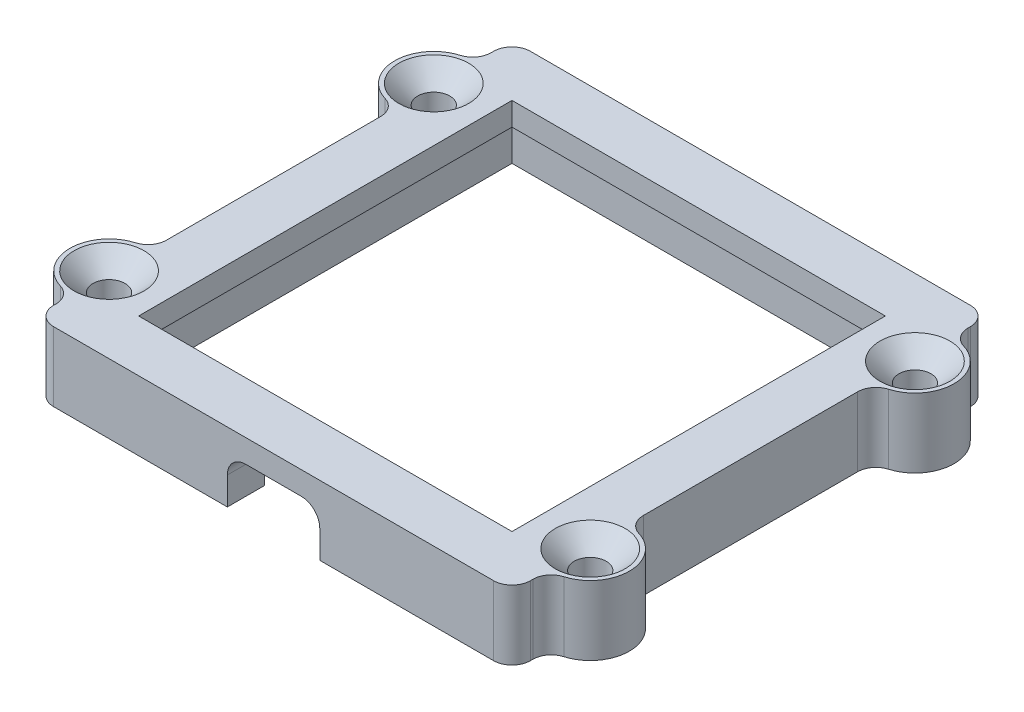
from build123d import *
from build123d.topology import SkipClean

# Parameters (mm, degrees)
BOSS_EXTRUDE1_DEPTH            = 3.175
SKETCH2_R                      = 1.1
SKETCH2_W                      = 27.686
SKETCH2_H                      = 27.686
SKETCH2_W_2                    = 25.654
SKETCH2_H_2                    = 25.654
BOSS_EXTRUDE2_DEPTH            = 1.5875
CHAMFER1_SIZE                  = 1.3
FILLET1_R                      = 1.27
CUT_EXTRUDE1_REACH             = 48.79
SKETCH3_W                      = 6.35
SKETCH3_H                      = 3.175
CUT_EXTRUDE1_DIRECTION_2_DEPTH = 47.790190032
FILLET2_R                      = 1.27


with BuildPart() as part:
    # Sketch1 → Boss-Extrude1 (new body)
    with BuildSketch(Plane(origin=(0, 0, 0), x_dir=(1, 0, 0), z_dir=(0, 1, 0))):
        with BuildLine():
            ThreePointArc((-2.54, 27.681949273), (-5.375, 24.9985), (-2.54, 22.315050727))
            Line((-2.54, 22.315050727), (-2.54, 23.908434062))
            ThreePointArc((-2.54, 23.908434062), (-3.7875, 24.9985), (-2.54, 26.088565938))
            Line((-2.54, 26.088565938), (-2.54, 27.681949273))
        make_face()
        with BuildLine():
            Line((-2.54, 23.908434062), (-2.54, 22.315050727))
            ThreePointArc((-2.54, 22.315050727), (-0.735697948, 23.151035521), (0, 24.9985))
            ThreePointArc((0, 24.9985), (-0.735697948, 26.845964479), (-2.54, 27.681949273))
            Line((-2.54, 27.681949273), (-2.54, 26.088565938))
            ThreePointArc((-2.54, 26.088565938), (-1.859173374, 25.722292097), (-1.5875, 24.9985))
            ThreePointArc((-1.5875, 24.9985), (-1.859173374, 24.274707903), (-2.54, 23.908434062))
        make_face()
        with BuildLine():
            ThreePointArc((-2.54, 27.681949273), (-0.735697948, 26.845964479), (0, 24.9985))
            Line((0, 24.9985), (0, 27.686))
            Line((0, 27.686), (27.686, 27.686))
            Line((27.686, 27.686), (27.686, 24.9985))
            ThreePointArc((27.686, 24.9985), (28.421697948, 26.845964479), (30.226, 27.681949273))
            Line((30.226, 27.681949273), (30.226, 30.226))
            Line((30.226, 30.226), (-2.54, 30.226))
            Line((-2.54, 30.226), (-2.54, 27.681949273))
        make_face()
        with BuildLine():
            ThreePointArc((-2.54, 27.681949273), (-5.375, 24.9985), (-2.54, 22.315050727))
            Line((-2.54, 22.315050727), (-2.54, 23.908434062))
            ThreePointArc((-2.54, 23.908434062), (-3.7875, 24.9985), (-2.54, 26.088565938))
            Line((-2.54, 26.088565938), (-2.54, 27.681949273))
        make_face()
        with BuildLine():
            Line((-2.54, 23.908434062), (-2.54, 22.315050727))
            ThreePointArc((-2.54, 22.315050727), (-0.735697948, 23.151035521), (0, 24.9985))
            ThreePointArc((0, 24.9985), (-0.735697948, 26.845964479), (-2.54, 27.681949273))
            Line((-2.54, 27.681949273), (-2.54, 26.088565938))
            ThreePointArc((-2.54, 26.088565938), (-1.859173374, 25.722292097), (-1.5875, 24.9985))
            ThreePointArc((-1.5875, 24.9985), (-1.859173374, 24.274707903), (-2.54, 23.908434062))
        make_face()
        with BuildLine():
            ThreePointArc((-2.54, 5.370949273), (-5.375, 2.6875), (-2.54, 0.004050727))
            Line((-2.54, 0.004050727), (-2.54, 1.597434062))
            ThreePointArc((-2.54, 1.597434062), (-3.7875, 2.6875), (-2.54, 3.777565938))
            Line((-2.54, 3.777565938), (-2.54, 5.370949273))
        make_face()
        with BuildLine():
            Line((-2.54, 1.597434062), (-2.54, 0.004050727))
            ThreePointArc((-2.54, 0.004050727), (-0.735697948, 0.840035521), (0, 2.6875))
            ThreePointArc((0, 2.6875), (-0.735697948, 4.534964479), (-2.54, 5.370949273))
            Line((-2.54, 5.370949273), (-2.54, 3.777565938))
            ThreePointArc((-2.54, 3.777565938), (-1.859173374, 3.411292097), (-1.5875, 2.6875))
            ThreePointArc((-1.5875, 2.6875), (-1.859173374, 1.963707903), (-2.54, 1.597434062))
        make_face()
        with BuildLine():
            ThreePointArc((-2.54, 5.370949273), (-5.375, 2.6875), (-2.54, 0.004050727))
            Line((-2.54, 0.004050727), (-2.54, 1.597434062))
            ThreePointArc((-2.54, 1.597434062), (-3.7875, 2.6875), (-2.54, 3.777565938))
            Line((-2.54, 3.777565938), (-2.54, 5.370949273))
        make_face()
        with BuildLine():
            Line((-2.54, 1.597434062), (-2.54, 0.004050727))
            ThreePointArc((-2.54, 0.004050727), (-0.735697948, 0.840035521), (0, 2.6875))
            ThreePointArc((0, 2.6875), (-0.735697948, 4.534964479), (-2.54, 5.370949273))
            Line((-2.54, 5.370949273), (-2.54, 3.777565938))
            ThreePointArc((-2.54, 3.777565938), (-1.859173374, 3.411292097), (-1.5875, 2.6875))
            ThreePointArc((-1.5875, 2.6875), (-1.859173374, 1.963707903), (-2.54, 1.597434062))
        make_face()
        with BuildLine():
            Line((-2.54, 22.315050727), (-2.54, 5.370949273))
            ThreePointArc((-2.54, 5.370949273), (-0.735697948, 4.534964479), (0, 2.6875))
            Line((0, 2.6875), (0, 24.9985))
            ThreePointArc((0, 24.9985), (-0.735697948, 23.151035521), (-2.54, 22.315050727))
        make_face()
        with BuildLine():
            Line((-2.54, 0.004050727), (-2.54, -2.54))
            Line((-2.54, -2.54), (30.226, -2.54))
            Line((30.226, -2.54), (30.226, 0.004050727))
            ThreePointArc((30.226, 0.004050727), (28.421697948, 0.840035521), (27.686, 2.6875))
            Line((27.686, 2.6875), (27.686, 0))
            Line((27.686, 0), (0, 0))
            Line((0, 0), (0, 2.6875))
            ThreePointArc((0, 2.6875), (-0.735697948, 0.840035521), (-2.54, 0.004050727))
        make_face()
        with BuildLine():
            Line((27.686, 24.9985), (27.686, 2.6875))
            ThreePointArc((27.686, 2.6875), (28.421697948, 4.534964479), (30.226, 5.370949273))
            Line((30.226, 5.370949273), (30.226, 22.315050727))
            ThreePointArc((30.226, 22.315050727), (28.421697948, 23.151035521), (27.686, 24.9985))
        make_face()
        with BuildLine():
            ThreePointArc((27.686, 2.6875), (28.421697948, 0.840035521), (30.226, 0.004050727))
            Line((30.226, 0.004050727), (30.226, 1.597434062))
            ThreePointArc((30.226, 1.597434062), (29.2735, 2.6875), (30.226, 3.777565938))
            Line((30.226, 3.777565938), (30.226, 5.370949273))
            ThreePointArc((30.226, 5.370949273), (28.421697948, 4.534964479), (27.686, 2.6875))
        make_face()
        with BuildLine():
            Line((30.226, 1.597434062), (30.226, 0.004050727))
            ThreePointArc((30.226, 0.004050727), (32.220964479, 0.735697948), (33.061, 2.6875))
            ThreePointArc((33.061, 2.6875), (32.220964479, 4.639302052), (30.226, 5.370949273))
            Line((30.226, 5.370949273), (30.226, 3.777565938))
            ThreePointArc((30.226, 3.777565938), (31.097292097, 3.515826626), (31.4735, 2.6875))
            ThreePointArc((31.4735, 2.6875), (31.097292097, 1.859173374), (30.226, 1.597434062))
        make_face()
        with BuildLine():
            ThreePointArc((27.686, 2.6875), (28.421697948, 0.840035521), (30.226, 0.004050727))
            Line((30.226, 0.004050727), (30.226, 1.597434062))
            ThreePointArc((30.226, 1.597434062), (29.2735, 2.6875), (30.226, 3.777565938))
            Line((30.226, 3.777565938), (30.226, 5.370949273))
            ThreePointArc((30.226, 5.370949273), (28.421697948, 4.534964479), (27.686, 2.6875))
        make_face()
        with BuildLine():
            Line((30.226, 1.597434062), (30.226, 0.004050727))
            ThreePointArc((30.226, 0.004050727), (32.220964479, 0.735697948), (33.061, 2.6875))
            ThreePointArc((33.061, 2.6875), (32.220964479, 4.639302052), (30.226, 5.370949273))
            Line((30.226, 5.370949273), (30.226, 3.777565938))
            ThreePointArc((30.226, 3.777565938), (31.097292097, 3.515826626), (31.4735, 2.6875))
            ThreePointArc((31.4735, 2.6875), (31.097292097, 1.859173374), (30.226, 1.597434062))
        make_face()
        with BuildLine():
            ThreePointArc((30.226, 27.681949273), (28.421697948, 26.845964479), (27.686, 24.9985))
            ThreePointArc((27.686, 24.9985), (28.421697948, 23.151035521), (30.226, 22.315050727))
            Line((30.226, 22.315050727), (30.226, 23.908434062))
            ThreePointArc((30.226, 23.908434062), (29.2735, 24.9985), (30.226, 26.088565938))
            Line((30.226, 26.088565938), (30.226, 27.681949273))
        make_face()
        with BuildLine():
            ThreePointArc((33.061, 24.9985), (32.220964479, 26.950302052), (30.226, 27.681949273))
            Line((30.226, 27.681949273), (30.226, 26.088565938))
            ThreePointArc((30.226, 26.088565938), (31.097292097, 25.826826626), (31.4735, 24.9985))
            ThreePointArc((31.4735, 24.9985), (31.097292097, 24.170173374), (30.226, 23.908434062))
            Line((30.226, 23.908434062), (30.226, 22.315050727))
            ThreePointArc((30.226, 22.315050727), (32.220964479, 23.046697948), (33.061, 24.9985))
        make_face()
        with BuildLine():
            ThreePointArc((30.226, 27.681949273), (28.421697948, 26.845964479), (27.686, 24.9985))
            ThreePointArc((27.686, 24.9985), (28.421697948, 23.151035521), (30.226, 22.315050727))
            Line((30.226, 22.315050727), (30.226, 23.908434062))
            ThreePointArc((30.226, 23.908434062), (29.2735, 24.9985), (30.226, 26.088565938))
            Line((30.226, 26.088565938), (30.226, 27.681949273))
        make_face()
        with BuildLine():
            ThreePointArc((33.061, 24.9985), (32.220964479, 26.950302052), (30.226, 27.681949273))
            Line((30.226, 27.681949273), (30.226, 26.088565938))
            ThreePointArc((30.226, 26.088565938), (31.097292097, 25.826826626), (31.4735, 24.9985))
            ThreePointArc((31.4735, 24.9985), (31.097292097, 24.170173374), (30.226, 23.908434062))
            Line((30.226, 23.908434062), (30.226, 22.315050727))
            ThreePointArc((30.226, 22.315050727), (32.220964479, 23.046697948), (33.061, 24.9985))
        make_face()
    extrude(amount=BOSS_EXTRUDE1_DEPTH)

    # Sketch2 → Boss-Extrude2 (add)
    # profile 1 of 2: a face of its own
    with SkipClean():  # the faces are left unmerged after this step: merging them gives an invalid solid
        with BuildSketch(Plane(origin=(0, 3.175, 0), x_dir=(1, 0, 0), z_dir=(0, 1, 0))):
            with BuildLine():
                Line((30.226, -2.54), (30.226, 0.004050727))
                ThreePointArc((30.226, 0.004050727), (33.061, 2.6875), (30.226, 5.370949273))
                Line((30.226, 5.370949273), (30.226, 22.315050727))
                ThreePointArc((30.226, 22.315050727), (33.061, 24.9985), (30.226, 27.681949273))
                Line((30.226, 27.681949273), (30.226, 30.226))
                Line((30.226, 30.226), (-2.54, 30.226))
                Line((-2.54, 30.226), (-2.54, 27.681949273))
                ThreePointArc((-2.54, 27.681949273), (-5.375, 24.9985), (-2.54, 22.315050727))
                Line((-2.54, 22.315050727), (-2.54, 5.370949273))
                ThreePointArc((-2.54, 5.370949273), (-5.375, 2.6875), (-2.54, 0.004050727))
                Line((-2.54, 0.004050727), (-2.54, -2.54))
                Line((-2.54, -2.54), (30.226, -2.54))
            make_face()
            with Locations(Location((30.3735, 2.6875, 0), (0, 0, 270))):
                Circle(SKETCH2_R, mode=Mode.SUBTRACT)
            with Locations(Location((30.3735, 24.9985, 0), (0, 0, 270))):
                Circle(SKETCH2_R, mode=Mode.SUBTRACT)
            with Locations(Location((-2.6875, 24.9985, 0), (0, 0, 270))):
                Circle(SKETCH2_R, mode=Mode.SUBTRACT)
            with Locations(Location((-2.6875, 2.6875, 0), (0, 0, 270))):
                Circle(SKETCH2_R, mode=Mode.SUBTRACT)
            with Locations((13.843, 13.843)):
                Rectangle(SKETCH2_W, SKETCH2_H, mode=Mode.SUBTRACT)
        # profile 2 of 2: a face of its own
        with BuildSketch(Plane(origin=(0, 3.175, 0), x_dir=(1, 0, 0), z_dir=(0, 1, 0))):
            with Locations((13.843, 13.843)):
                Rectangle(SKETCH2_W, SKETCH2_H)
            with Locations((13.843, 13.843)):
                Rectangle(SKETCH2_W_2, SKETCH2_H_2, mode=Mode.SUBTRACT)
        extrude(amount=BOSS_EXTRUDE2_DEPTH)

    # Chamfer1
    chamfer1_edges = [part.edges().sort_by_distance(p)[0] for p in [
        (30.3735, 4.7625, -3.7875),
        (30.3735, 4.7625, -26.0985),
        (-2.6875, 4.7625, -26.0985),
        (-2.6875, 4.7625, -3.7875),
    ]]
    chamfer(chamfer1_edges, length=CHAMFER1_SIZE)

    # Fillet1
    fillet1_edges = [part.edges().sort_by_distance(p)[0] for p in [
        (30.226, 1.5875, -0.004050727),
        (30.226, 1.5875, 2.54),
        (-2.54, 1.5875, 2.54),
        (-2.54, 1.5875, -0.004050727),
        (-2.54, 1.5875, -5.370949273),
        (-2.54, 1.5875, -22.315050727),
        (-2.54, 1.5875, -27.681949273),
        (-2.54, 1.5875, -30.226),
        (30.226, 1.5875, -30.226),
        (30.226, 1.5875, -27.681949273),
        (30.226, 1.5875, -22.315050727),
        (30.226, 1.5875, -5.370949273),
    ]]
    fillet(fillet1_edges, radius=FILLET1_R)

    # Sketch3 → Cut-Extrude1 (cut, up to next)
    with BuildSketch(Plane.XY.offset(2.54), mode=Mode.PRIVATE) as cut_extrude1_sk1:
        with Locations((13.843, 1.5875)):
            Rectangle(SKETCH3_W, SKETCH3_H)
    cut_extrude1_tool1 = extrude(cut_extrude1_sk1.sketch, amount=-CUT_EXTRUDE1_REACH, mode=Mode.PRIVATE) & part.part
    add(cut_extrude1_tool1.solids().sort_by_distance((13.843, 1.5875, 2.54))[0], mode=Mode.SUBTRACT)

    # Sketch3 → Cut-Extrude1 direction 2 (cut)
    with SkipClean():  # the faces are left unmerged after this step: merging them gives an invalid solid
        with BuildSketch(Plane.XY.offset(2.54)):
            with Locations((13.843, 1.5875)):
                Rectangle(SKETCH3_W, SKETCH3_H)
        extrude(amount=CUT_EXTRUDE1_DIRECTION_2_DEPTH, mode=Mode.SUBTRACT)

    # Fillet2
    # the kernel refuses this fillet: 1.27 mm, written as the material it adds along each edge
    with BuildSketch(Plane(origin=(17.018, 3.175, 2.54), x_dir=(-1, 0, 0), z_dir=(0, 0, -1))) as fillet2_piece_1:
        with BuildLine():
            CenterArc((FILLET2_R, -FILLET2_R), FILLET2_R, 90, 90)
            Line((0, -FILLET2_R), (0, 0))
            Line((0, 0), (FILLET2_R, 0))
        make_face()
    extrude(amount=2.54)
    with BuildSketch(Plane(origin=(10.668, 3.175, 2.54), x_dir=(1, 0, 0), z_dir=(0, 0, -1))) as fillet2_piece_2:
        with BuildLine():
            CenterArc((FILLET2_R, FILLET2_R), FILLET2_R, 180, 90)
            Line((0, FILLET2_R), (0, 0))
            Line((0, 0), (FILLET2_R, 0))
        make_face()
    extrude(amount=2.54)


solid = part.part
